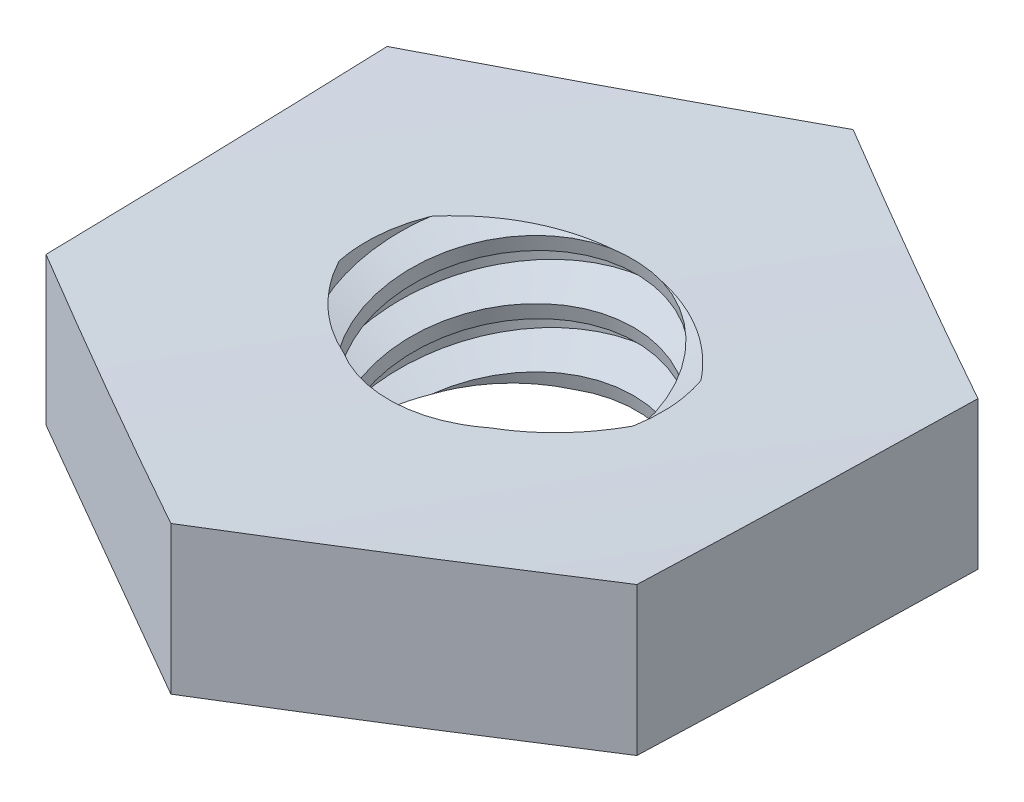
from build123d import *

# Parameters (mm, degrees)
EXTRUDE1_DEPTH       = 0.8
SKETCH2_W            = 1
SKETCH2_H            = 1.6
LPATTERN1_COUNT      = 4
LPATTERN1_PITCH      = 0.4
LPATTERN1_COUNT_DIR2 = 2
LPATTERN1_PITCH_DIR2 = 0.4
CUT_EXTRUDE1_DEPTH   = 10


with BuildPart() as part:
    # Sketch1 → Extrude1 (new, symmetric)
    with BuildSketch(Plane(origin=(0, 0, 0), x_dir=(1, 0, 0), z_dir=(0, 1, 0))):
        Polygon((0, 2.309401077), (-2, 1.154700538), (-2, -1.154700538), (0, -2.309401077), (2, -1.154700538), (2, 1.154700538), align=None)
    extrude(amount=EXTRUDE1_DEPTH, both=True)

    # Sketch4 → Cut-Revolve2 (revolve, cut)
    with BuildSketch(Plane(origin=(0, 0, 0), x_dir=(0, 0, -1), z_dir=(1, 0, 0))):
        Polygon((0, 0.8), (1, 0.8), (0.82201838, 0.717005807), (0.82201838, -0.717005807), (1, -0.8), (0, -0.8), align=None)
    revolve(axis=Axis((0, 0.8, 0), (0, 1, 0)), mode=Mode.SUBTRACT)


with BuildPart() as body_2:
    # Sketch2 → Revolve1 (revolve)
    with BuildSketch(Plane(origin=(0, 0, 0), x_dir=(0, 0, -1), z_dir=(1, 0, 0))):
        with Locations((0.5, 0)):
            Rectangle(SKETCH2_W, SKETCH2_H)
    revolve(axis=Axis((0, -1.8, 0), (0, 1, 0)))

    # Sketch3 → Cut-Revolve1 (revolve, cut)
    with BuildSketch(Plane(origin=(0, 0, 0), x_dir=(0, 0, -1), z_dir=(1, 0, 0))):
        Polygon((1.009805807, 0.750970966), (1.078446454, 0.40776773), (0.841629993, 0.487879925), (0.82201838, 0.585937993), align=None)
    cut_revolve1 = revolve(axis=Axis((0, 0.8, 0.085891176), (0, -0.9805806756909201, -0.19611613513818416)), mode=Mode.SUBTRACT)

    # LPattern1: Cut-Revolve1 4 × 2
    with Locations(*[Vector(0, -1, 0) * (i * LPATTERN1_PITCH) + Vector(0, 1, 0) * (j * LPATTERN1_PITCH_DIR2) for i in range(LPATTERN1_COUNT) for j in range(LPATTERN1_COUNT_DIR2) if (i, j) != (0, 0)]):
        add(cut_revolve1, mode=Mode.SUBTRACT)


with BuildPart() as part_1:
    add(part.part)

    # Combine1: cut body 2
    add(body_2.part, mode=Mode.SUBTRACT)

    # Sketch6 → Cut-Extrude1 (cut)
    with BuildSketch(Plane(origin=(-1, 0, 1.732050808), x_dir=(0.8660254037844386, 0, 0.5), z_dir=(-0.5000000000000001, 0, 0.8660254037844387))):
        with BuildLine():
            ThreePointArc((-9.048253748, 1.529048513), (0, 0.179159881), (9.048253748, 1.529048513))
            add(Edge.make_bspline(
                [(9.048253748, 1.529048513), (0.30516196, 6.548590319), (-9.048253748, 1.529048513)],
                knots=[0, 0, 0, 1, 1, 1], degree=2))
        make_face()
        with BuildLine():
            ThreePointArc((-9.370997107, 0.58202908), (0, -0.820840119), (9.370997107, 0.58202908))
            add(Edge.make_bspline(
                [(-9.370997107, 0.58202908), (0.133381253, -6.42773587), (9.370997107, 0.58202908)],
                knots=[0, 0, 0, 1, 1, 1], degree=2))
        make_face()
    extrude(amount=-CUT_EXTRUDE1_DEPTH, mode=Mode.SUBTRACT)


solid = part_1.part
